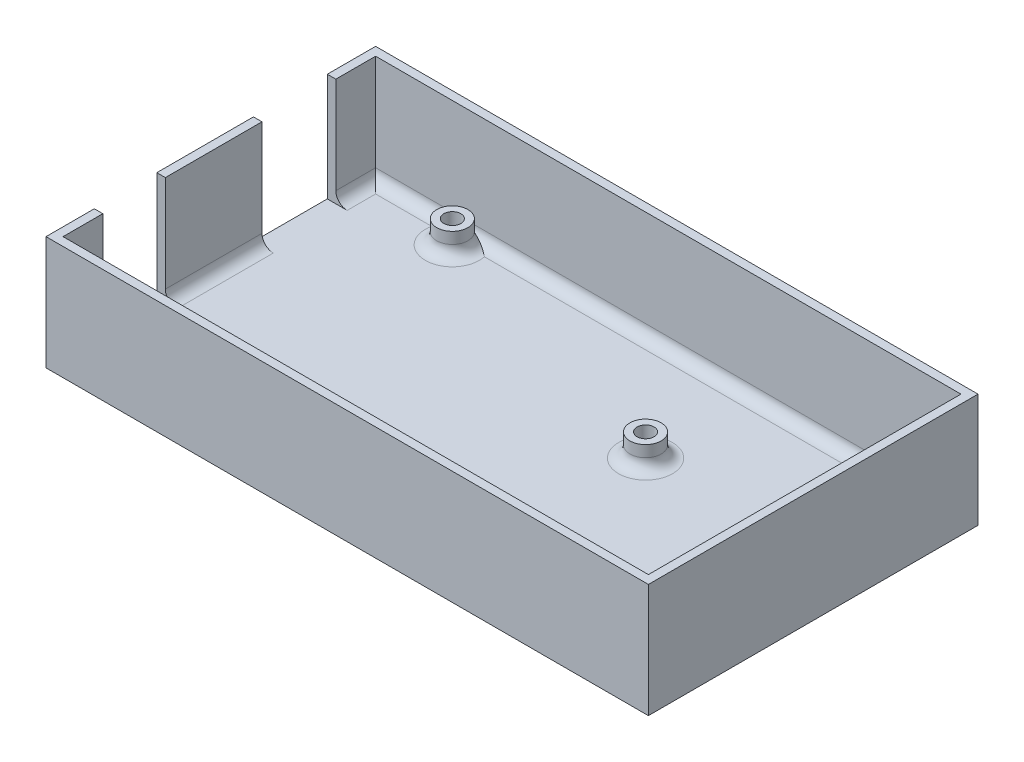
from build123d import *

# Parameters (mm, degrees)
SKETCH1_W           = 106
SKETCH1_H           = 58
SKETCH1_W_2         = 103
SKETCH1_H_2         = 55
SKETCH1_R           = 1.5
BOSS_EXTRUDE1_DEPTH = 1
SKETCH4_R           = 2.75
SKETCH4_R_2         = 1.5
BOSS_EXTRUDE4_DEPTH = 4
SKETCH5_W           = 1.5
SKETCH5_H           = 17
BOSS_EXTRUDE5_DEPTH = 19
FILLET1_R           = 2


with BuildPart() as part:
    # Sketch1 → Boss-Extrude1 (new body)
    # profile 1 of 2: a face of its own
    with BuildSketch(Plane(origin=(0, 0, 0), x_dir=(1, 0, 0), z_dir=(0, 1, 0))):
        Rectangle(SKETCH1_W, SKETCH1_H)
        Rectangle(SKETCH1_W_2, SKETCH1_H_2, mode=Mode.SUBTRACT)
    # profile 2 of 2: a face of its own
    with BuildSketch(Plane(origin=(0, 0, 0), x_dir=(1, 0, 0), z_dir=(0, 1, 0))):
        Rectangle(SKETCH1_W_2, SKETCH1_H_2)
        with Locations(Location((46, -24, 0), (0, 0, 270))):
            Circle(SKETCH1_R, mode=Mode.SUBTRACT)
        with Locations(Location((14.5, 9, 0), (0, 0, 270))):
            Circle(SKETCH1_R, mode=Mode.SUBTRACT)
        with Locations(Location((14.5, -19, 0), (0, 0, 270))):
            Circle(SKETCH1_R, mode=Mode.SUBTRACT)
        with Locations(Location((-36.5, -24, 0), (0, 0, 270))):
            Circle(SKETCH1_R, mode=Mode.SUBTRACT)
        with Locations(Location((-35, 24.5, 0), (0, 0, 270))):
            Circle(SKETCH1_R, mode=Mode.SUBTRACT)
    extrude(amount=BOSS_EXTRUDE1_DEPTH)

    # Sketch4 → Boss-Extrude4 (add)
    # profile 1 of 5: a face of its own
    with BuildSketch(Plane(origin=(0, 1, 0), x_dir=(1, 0, 0), z_dir=(0, 1, 0))):
        with Locations(Location((-35, 24.5, 0), (0, 0, 270))):
            Circle(SKETCH4_R)
        with Locations(Location((-35, 24.5, 0), (0, 0, 270))):
            Circle(SKETCH4_R_2, mode=Mode.SUBTRACT)
    # profile 2 of 5: a face of its own
    with BuildSketch(Plane(origin=(0, 1, 0), x_dir=(1, 0, 0), z_dir=(0, 1, 0))):
        with Locations(Location((14.5, 9, 0), (0, 0, 270))):
            Circle(SKETCH4_R)
        with Locations(Location((14.5, 9, 0), (0, 0, 270))):
            Circle(SKETCH4_R_2, mode=Mode.SUBTRACT)
    # profile 3 of 5: a face of its own
    with BuildSketch(Plane(origin=(0, 1, 0), x_dir=(1, 0, 0), z_dir=(0, 1, 0))):
        with Locations(Location((46, -24, 0), (0, 0, 270))):
            Circle(SKETCH4_R)
        with Locations(Location((46, -24, 0), (0, 0, 270))):
            Circle(SKETCH4_R_2, mode=Mode.SUBTRACT)
    # profile 4 of 5: a face of its own
    with BuildSketch(Plane(origin=(0, 1, 0), x_dir=(1, 0, 0), z_dir=(0, 1, 0))):
        with Locations(Location((14.5, -19, 0), (0, 0, 270))):
            Circle(SKETCH4_R)
        with Locations(Location((14.5, -19, 0), (0, 0, 270))):
            Circle(SKETCH4_R_2, mode=Mode.SUBTRACT)
    # profile 5 of 5: a face of its own
    with BuildSketch(Plane(origin=(0, 1, 0), x_dir=(1, 0, 0), z_dir=(0, 1, 0))):
        with Locations(Location((-36.5, -24, 0), (0, 0, 270))):
            Circle(SKETCH4_R)
        with Locations(Location((-36.5, -24, 0), (0, 0, 270))):
            Circle(SKETCH4_R_2, mode=Mode.SUBTRACT)
    extrude(amount=BOSS_EXTRUDE4_DEPTH)

    # Sketch5 → Boss-Extrude5 (add)
    with BuildSketch(Plane(origin=(0, 1, 0), x_dir=(1, 0, 0), z_dir=(0, 1, 0))):
        Polygon((-51.5, -20.5), (-51.5, -27.5), (51.5, -27.5), (51.5, 27.5), (-51.5, 27.5), (-51.5, 20.5), (-53, 20.5), (-53, 29), (53, 29), (53, -29), (-53, -29), (-53, -20.5), align=None)
        with Locations((-52.25, -1)):
            Rectangle(SKETCH5_W, SKETCH5_H)
    extrude(amount=BOSS_EXTRUDE5_DEPTH)

    # Fillet1
    # the kernel refuses this fillet: 2 mm, written as the material it adds along each edge
    with BuildSketch(Plane(origin=(-35, 1, -24.5), x_dir=(0, 0, 1), z_dir=(-1, 0, 0))) as fillet1_piece_1_section:
        with BuildLine():
            CenterArc((2.75 + FILLET1_R, FILLET1_R), FILLET1_R, 180, 90)
            Line((2.75, FILLET1_R), (2.75, 0))
            Line((2.75, 0), (2.75 + FILLET1_R, 0))
        make_face()
    fillet1_piece_1 = revolve(axis=Axis((-35, 1, -24.5), (0, 1, 0)), mode=Mode.PRIVATE)
    fillet1_piece_1 = split(fillet1_piece_1, bisect_by=Plane(origin=(-31.340267313, 1.044014646, -29), z_dir=(0, 0, 1)), keep=Keep.TOP, mode=Mode.PRIVATE)
    add(fillet1_piece_1)
    with BuildSketch(Plane(origin=(14.5, 1, -9), x_dir=(0, 0, 1), z_dir=(-1, 0, 0))) as fillet1_piece_2:
        with BuildLine():
            CenterArc((2.75 + FILLET1_R, FILLET1_R), FILLET1_R, 180, 90)
            Line((2.75, FILLET1_R), (2.75, 0))
            Line((2.75, 0), (2.75 + FILLET1_R, 0))
        make_face()
    revolve(axis=Axis((14.5, 1, -9), (0, 1, 0)))
    with BuildSketch(Plane(origin=(46, 1, 24), x_dir=(0, 0, 1), z_dir=(-1, 0, 0))) as fillet1_piece_3:
        with BuildLine():
            CenterArc((2.75 + FILLET1_R, FILLET1_R), FILLET1_R, 180, 90)
            Line((2.75 + FILLET1_R, 0), (2.75, 0))
            Line((2.75, 0), (2.75, FILLET1_R))
        make_face()
    revolve(axis=Axis((46, 1, 24), (0, 1, 0)))
    with BuildSketch(Plane(origin=(14.5, 1, 19), x_dir=(0, 0, 1), z_dir=(-1, 0, 0))) as fillet1_piece_4:
        with BuildLine():
            CenterArc((2.75 + FILLET1_R, FILLET1_R), FILLET1_R, 180, 90)
            Line((2.75, FILLET1_R), (2.75, 0))
            Line((2.75, 0), (2.75 + FILLET1_R, 0))
        make_face()
    revolve(axis=Axis((14.5, 1, 19), (0, 1, 0)))
    with BuildSketch(Plane(origin=(-36.5, 1, 24), x_dir=(0, 0, 1), z_dir=(-1, 0, 0))) as fillet1_piece_5:
        with BuildLine():
            CenterArc((2.75 + FILLET1_R, FILLET1_R), FILLET1_R, 180, 90)
            Line((2.75, FILLET1_R), (2.75, 0))
            Line((2.75, 0), (2.75 + FILLET1_R, 0))
        make_face()
    revolve(axis=Axis((-36.5, 1, 24), (0, 1, 0)))
    with BuildSketch(Plane(origin=(-51.5, 1, -32.5), x_dir=(1, 0, 0), z_dir=(0, 0, 1))) as fillet1_piece_6_section:
        with BuildLine():
            CenterArc((FILLET1_R, FILLET1_R), FILLET1_R, 180, 90)
            Line((0, FILLET1_R), (0, 0))
            Line((0, 0), (FILLET1_R, 0))
        make_face()
    fillet1_piece_6 = extrude(amount=12, mode=Mode.PRIVATE)
    fillet1_piece_6 = split(fillet1_piece_6, bisect_by=Plane(origin=(-51.053264122, 1.446735878, -29), z_dir=(0, 0, 1)), keep=Keep.TOP, mode=Mode.PRIVATE)
    add(fillet1_piece_6)
    with BuildSketch(Plane(origin=(56.5, 1, -27.5), x_dir=(0, 0, 1), z_dir=(-1, 0, 0))) as fillet1_piece_7_section:
        with BuildLine():
            CenterArc((FILLET1_R, FILLET1_R), FILLET1_R, 180, 90)
            Line((0, FILLET1_R), (0, 0))
            Line((0, 0), (FILLET1_R, 0))
        make_face()
    fillet1_piece_7 = extrude(amount=113, mode=Mode.PRIVATE)
    fillet1_piece_7 = fillet1_piece_7 - Plane(origin=(-35, 1.450094652, -24.5), x_dir=(0, 0, 1), z_dir=(0, -1, 0)) * Cylinder(1.5, 234, mode=Mode.PRIVATE)
    fillet1_piece_7 = split(fillet1_piece_7, bisect_by=Plane(origin=(53, 1.450094652, -27.058704207), z_dir=(-1, 0, 0)), keep=Keep.TOP, mode=Mode.PRIVATE)
    fillet1_piece_7 = split(fillet1_piece_7, bisect_by=Plane(origin=(-53, 1.450094652, -27.058704207), z_dir=(1, 0, 0)), keep=Keep.TOP, mode=Mode.PRIVATE)
    add(fillet1_piece_7)
    with BuildSketch(Plane(origin=(51.5, 1, 27.5), x_dir=(-1, 0, 0), z_dir=(0, 0, -1))) as fillet1_piece_8_section:
        with BuildLine():
            CenterArc((FILLET1_R, FILLET1_R), FILLET1_R, 180, 90)
            Line((0, FILLET1_R), (0, 0))
            Line((0, 0), (FILLET1_R, 0))
        make_face()
    fillet1_piece_8 = extrude(amount=60, mode=Mode.PRIVATE)
    fillet1_piece_8 = split(fillet1_piece_8, bisect_by=Plane(origin=(51.053264122, 1.446735878, -29), z_dir=(0, 0, 1)), keep=Keep.TOP, mode=Mode.PRIVATE)
    add(fillet1_piece_8)
    with BuildSketch(Plane(origin=(-56.5, 1, 27.5), x_dir=(0, 0, -1), z_dir=(1, 0, 0))) as fillet1_piece_9_section:
        with BuildLine():
            CenterArc((FILLET1_R, FILLET1_R), FILLET1_R, 180, 90)
            Line((0, FILLET1_R), (0, 0))
            Line((0, 0), (FILLET1_R, 0))
        make_face()
    fillet1_piece_9 = extrude(amount=113, mode=Mode.PRIVATE)
    fillet1_piece_9 = split(fillet1_piece_9, bisect_by=Plane(origin=(53, 1.449828353, 27.059644871), z_dir=(-1, 0, 0)), keep=Keep.TOP, mode=Mode.PRIVATE)
    fillet1_piece_9 = split(fillet1_piece_9, bisect_by=Plane(origin=(-53, 1.449828353, 27.059644871), z_dir=(1, 0, 0)), keep=Keep.TOP, mode=Mode.PRIVATE)
    add(fillet1_piece_9)
    with BuildSketch(Plane(origin=(-51.5, 1, 20.5), x_dir=(1, 0, 0), z_dir=(0, 0, 1))) as fillet1_piece_10:
        with BuildLine():
            CenterArc((FILLET1_R, FILLET1_R), FILLET1_R, 180, 90)
            Line((0, FILLET1_R), (0, 0))
            Line((0, 0), (FILLET1_R, 0))
        make_face()
    extrude(amount=7)
    with BuildSketch(Plane(origin=(-51.5, 1, -7.5), x_dir=(1, 0, 0), z_dir=(0, 0, 1))) as fillet1_piece_11:
        with BuildLine():
            CenterArc((FILLET1_R, FILLET1_R), FILLET1_R, 180, 90)
            Line((0, FILLET1_R), (0, 0))
            Line((0, 0), (FILLET1_R, 0))
        make_face()
    extrude(amount=17)


solid = part.part
